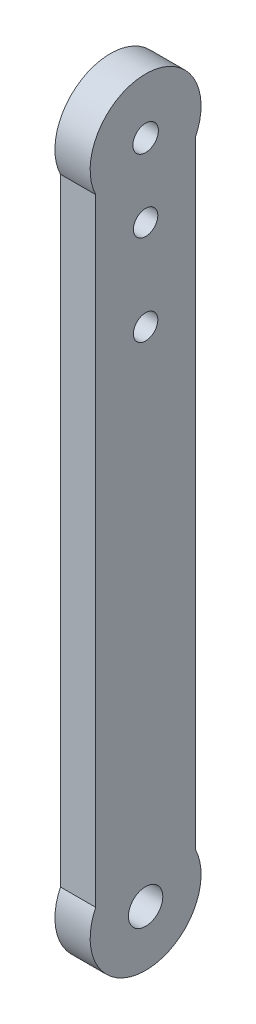
from build123d import *

# Parameters (mm, degrees)
SKETCH1_R           = 1.55
SKETCH1_R_2         = 1.1
SKETCH1_R_3         = 1.15
BOSS_EXTRUDE3_DEPTH = 3.175


with BuildPart() as part:
    # Sketch1 → Boss-Extrude3 (new body)
    with BuildSketch(Plane(origin=(0, 0, 0), x_dir=(0, 0, -1), z_dir=(1, 0, 0))):
        with BuildLine():
            Line((4.5, -2.179449472), (4.5, -57.820550528))
            ThreePointArc((4.5, -57.820550528), (0, -65), (-4.5, -57.820550528))
            Line((-4.5, -57.820550528), (-4.5, -2.179449472))
            ThreePointArc((-4.5, -2.179449472), (0, 5), (4.5, -2.179449472))
        make_face()
        with Locations((0, -60)):
            Circle(SKETCH1_R, mode=Mode.SUBTRACT)
        with Locations((0, -14.75)):
            Circle(SKETCH1_R_2, mode=Mode.SUBTRACT)
        Circle(SKETCH1_R_3, mode=Mode.SUBTRACT)
        with Locations((0, -6.6)):
            Circle(SKETCH1_R_2, mode=Mode.SUBTRACT)
    extrude(amount=BOSS_EXTRUDE3_DEPTH)


solid = part.part
